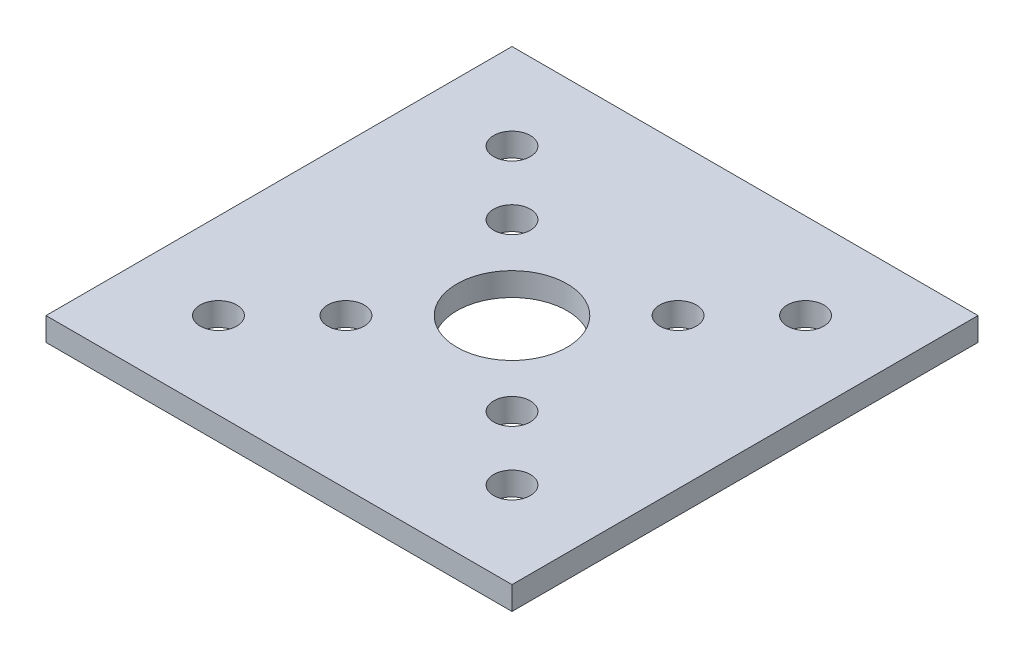
from build123d import *

# Parameters (mm, degrees)
SKETCH1_W           = 63.5
SKETCH1_H           = 63.5
BOSS_EXTRUDE1_DEPTH = 3.175
SKETCH2_R           = 2.5
SKETCH2_R_2         = 7.5
CUT_EXTRUDE1_DEPTH  = 46.01339384


with BuildPart() as part:
    # Sketch1 → Boss-Extrude1 (new body)
    with BuildSketch(Plane(origin=(0, 0, 0), x_dir=(1, 0, 0), z_dir=(0, 1, 0))):
        Rectangle(SKETCH1_W, SKETCH1_H)
    extrude(amount=BOSS_EXTRUDE1_DEPTH)

    # Sketch2 → Cut-Extrude1 (cut, through all)
    with BuildSketch(Plane(origin=(0, 3.175, 0), x_dir=(1, 0, 0), z_dir=(0, 1, 0))):
        with Locations((11.313708499, 11.313708499)):
            Circle(SKETCH2_R)
        with Locations((11.313708499, -11.313708499)):
            Circle(SKETCH2_R)
        with Locations((-11.313708499, -11.313708499)):
            Circle(SKETCH2_R)
        with Locations((-11.313708499, 11.313708499)):
            Circle(SKETCH2_R)
        Circle(SKETCH2_R_2)
        with Locations((-20, -20)):
            Circle(SKETCH2_R)
        with Locations((20, -20)):
            Circle(SKETCH2_R)
        with Locations((20, 20)):
            Circle(SKETCH2_R)
        with Locations((-20, 20)):
            Circle(SKETCH2_R)
    extrude(amount=-CUT_EXTRUDE1_DEPTH, mode=Mode.SUBTRACT)


solid = part.part
